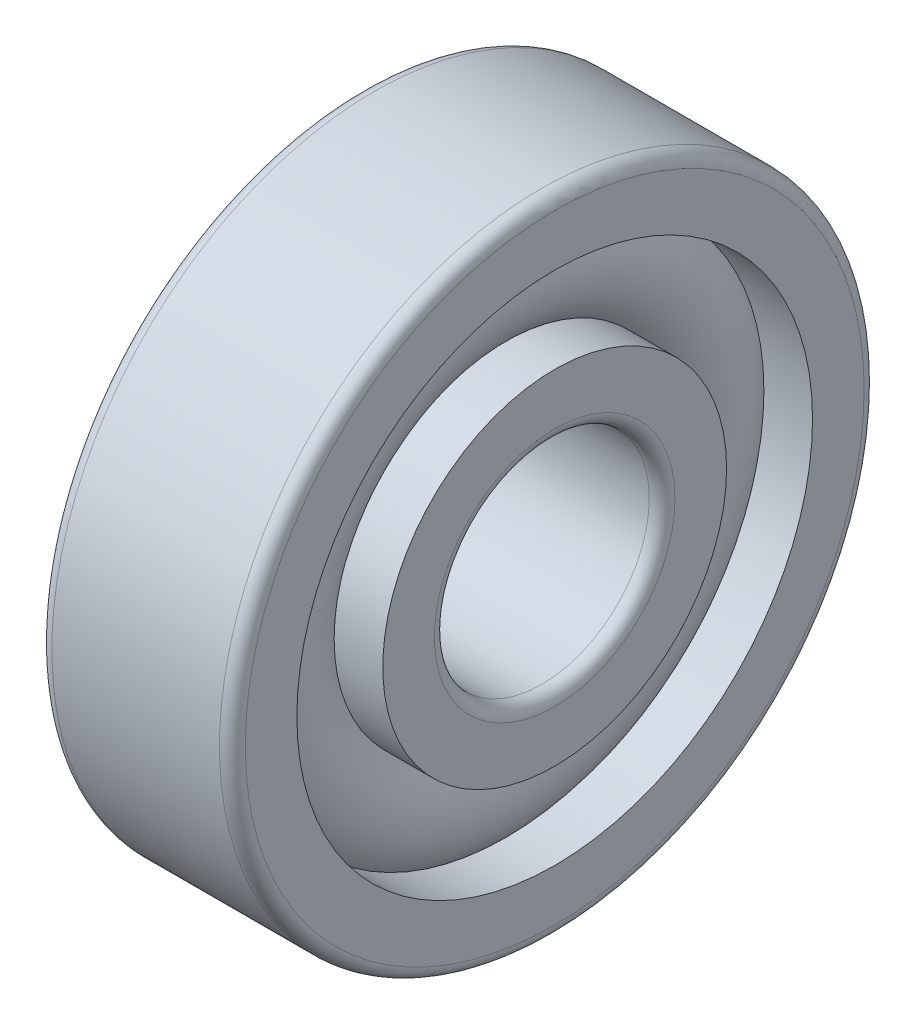
from build123d import *

# Parameters (mm, degrees)
CAGSPISKE_W     = 0.6
CAGSPISKE_H     = 1
CAGESPINE_ANGLE = 0.001
BALSIMSKE_R     = 3


with BuildPart() as part:
    # CagSpiSke → CageSpine (revolve)
    with BuildSketch(Plane.XY):
        with Locations((0, 10)):
            Rectangle(CAGSPISKE_W, CAGSPISKE_H)
    revolve(axis=Axis((-20.6375, 0, 0), (-1, 0, 0)), revolution_arc=CAGESPINE_ANGLE)

    # BalSimSke → BallsSimplified (revolve)
    with BuildSketch(Plane.XY):
        with Locations((0, 10)):
            Circle(BALSIMSKE_R)
    revolve(axis=Axis((-10, 0, 0), (1, 0, 0)))

    # InnRacSke → InnerRace (revolve)
    with BuildSketch(Plane.XY):
        with BuildLine():
            Line((-2.202413449, 8), (-4.5, 8))
            Line((-4.5, 8), (-4.5, 5.6))
            ThreePointArc((-4.5, 5.6), (-4.324264069, 5.175735931), (-3.9, 5))
            Line((-3.9, 5), (3.9, 5))
            ThreePointArc((3.9, 5), (4.324264069, 5.175735931), (4.5, 5.6))
            Line((4.5, 5.6), (4.5, 8))
            Line((4.5, 8), (2.202413449, 8))
            ThreePointArc((2.202413449, 8), (0, 7.025), (-2.202413449, 8))
        make_face()
    revolve(axis=Axis((-20.6375, 0, 0), (1, 0, 0)))

    # OutRacSke → OuterRace (revolve)
    with BuildSketch(Plane.XY):
        with BuildLine():
            Line((-2.202413449, 12), (-4.5, 12))
            Line((-4.5, 12), (-4.5, 14.4))
            ThreePointArc((-4.5, 14.4), (-4.324264069, 14.824264069), (-3.9, 15))
            Line((-3.9, 15), (3.9, 15))
            ThreePointArc((3.9, 15), (4.324264069, 14.824264069), (4.5, 14.4))
            Line((4.5, 14.4), (4.5, 12))
            Line((4.5, 12), (2.202413449, 12))
            ThreePointArc((2.202413449, 12), (0, 12.975), (-2.202413449, 12))
        make_face()
    revolve(axis=Axis((-20.6375, 0, 0), (1, 0, 0)))


solid = part.part
